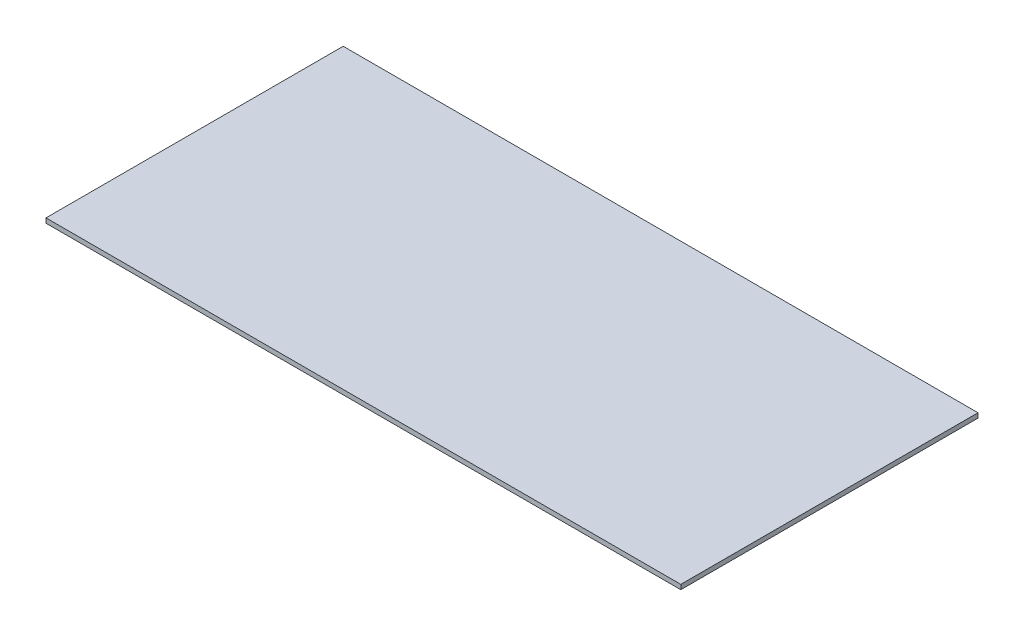
from build123d import *

# Parameters (mm, degrees)
SKETCH1_W           = 1730
SKETCH1_H           = 810
BOSS_EXTRUDE1_DEPTH = 12.7


with BuildPart() as part:
    # Sketch1 → Boss-Extrude1 (new body)
    with BuildSketch(Plane(origin=(0, 0, 0), x_dir=(1, 0, 0), z_dir=(0, 1, 0))):
        Rectangle(SKETCH1_W, SKETCH1_H)
    extrude(amount=BOSS_EXTRUDE1_DEPTH)


solid = part.part
